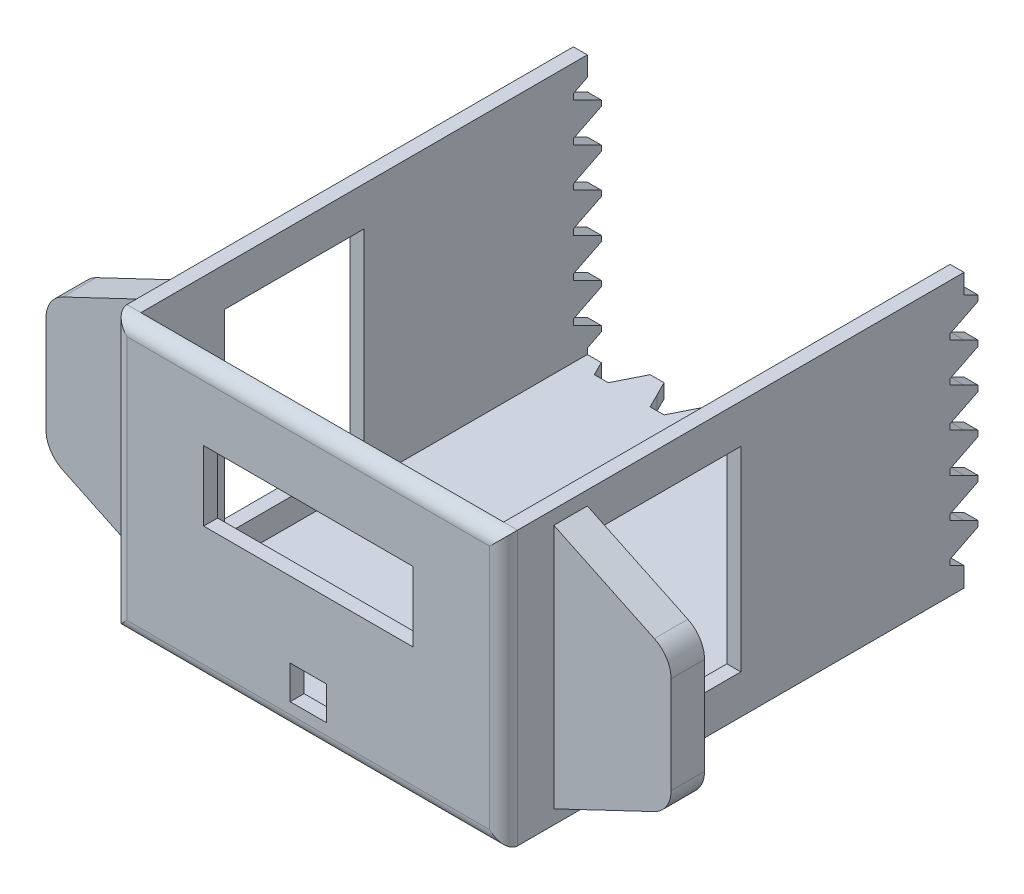
from build123d import *
from OCP.BRepFilletAPI import BRepFilletAPI_MakeChamfer

# Parameters (mm, degrees)
SKETCH1_W                  = 140
SKETCH1_H                  = 98
BOSS_EXTRUDE1_DEPTH        = 170
FACE_FILLET_R              = 5
INTERIOR_START             = -5
INTERIOR_SKETCH_W          = 130
INTERIOR_SKETCH_H          = 93
INTERIOR_CUT_DEPTH         = 199.045897155
DISPLAY_SKETCH_W           = 75
DISPLAY_SKETCH_H           = 25
DISPLAY_CUT_DEPTH          = 5
WINDOW_CUT_REACH           = 231.478
WINDOW_SKETCH_W            = 50
WINDOW_SKETCH_H            = 70
TEETH_START                = -5
TEETH_CUT_1_DEPTH          = 5
TEETH_CUT_2_DEPTH          = 5
TEETH_CUT_BOT_DEPTH        = 5
WIRE_HOLE_SKETCH_W         = 13
WIRE_HOLE_SKETCH_H         = 12
WIRE_HOLE_CUT_DEPTH        = 5
SERVO_START                = -5
MOUNT_SKETCH_1_W           = 12
MOUNT_SKETCH_1_H           = 88
SERVO_MOUNT_1_DEPTH        = 42
MOUNT_SKETCH_2_W           = 12
MOUNT_SKETCH_2_H           = 88
SERVO_MOUNT_2_DEPTH        = 42
SERVO_START_2              = -12
INDENT_SKETCH_1_R          = 10.6
SERVO_INDENT_1_DEPTH       = 2.5
INDENT_SKETCH_2_R          = 10.6
SERVO_INDENT_2_DEPTH       = 2.5
SERVO_MOUNT_CHAMFER_SIZE   = 42
SERVO_MOUNT_CHAMFER_SIZE_2 = 20
SERVO_MOUNT_FILLET_R       = 10.5
BELLY_SKETCH_W             = 3.5
BELLY_SKETCH_H             = 3.983739837
BELLY_SUPPORTS_DEPTH       = 31
BELLY_START                = 31
SKETCH2_4_W                = 3.5
SKETCH2_4_H                = 3.983739837
BELLY_PLATE_DEPTH          = 4
BELLY_CUT_SKETCH_W         = 54.5
BELLY_CUT_SKETCH_H         = 66.016260163
BELLY_CUT_DEPTH            = 2
WIRE_HOLE_2_SKETCH_R       = 10
WIRE_HOLE_2_CUT_DEPTH      = 5


# Read off the part's stored shape, not the designer's step: Teeth Cut 1, Teeth Cut 2, Teeth Cut Bot
with BuildPart() as part:
    # Sketch1 → Boss-Extrude1 (new body)
    with BuildSketch(Plane.XY):
        with Locations((-20.374701232, -15.49844749)):
            Rectangle(SKETCH1_W, SKETCH1_H)
    extrude(amount=-BOSS_EXTRUDE1_DEPTH)

    # Face Fillet
    face_fillet_edges = [part.edges().sort_by_distance(p)[0] for p in [
        (-20.374701232, 33.50155251, 0),
        (49.625298768, -15.49844749, 0),
        (-20.374701232, -64.49844749, 0),
        (-90.374701232, -15.49844749, 0),
    ]]
    fillet(face_fillet_edges, radius=FACE_FILLET_R)

    # Interior Sketch → Interior Cut (cut, through all)
    with BuildSketch(Plane.XY.offset(INTERIOR_START)):
        with Locations((-20.374701232, -12.99844749)):
            Rectangle(INTERIOR_SKETCH_W, INTERIOR_SKETCH_H)
    extrude(amount=-INTERIOR_CUT_DEPTH, mode=Mode.SUBTRACT)

    # Display Sketch → Display Cut (cut)
    with BuildSketch(Plane.XY):
        with Locations((-20.374701232, -3.99844749)):
            Rectangle(DISPLAY_SKETCH_W, DISPLAY_SKETCH_H)
    extrude(amount=-DISPLAY_CUT_DEPTH, mode=Mode.SUBTRACT)

    # Window Cut: up to this face of the body (flat: up to its plane)
    window_cut_end = Plane(part.part.faces().sort_by_distance((-90.374701232, -15.49844749, -87.5))[0])
    # Window Sketch → Window Cut (cut, up to the picked face)
    with BuildSketch(Plane(origin=(49.625298768, 0, 0), x_dir=(0, 0, -1), z_dir=(1, 0, 0)), mode=Mode.PRIVATE) as window_cut_sk1:
        with Locations((60, -15.49844749)):
            Rectangle(WINDOW_SKETCH_W, WINDOW_SKETCH_H)
    window_cut_tool1 = split(extrude(window_cut_sk1.sketch, amount=-WINDOW_CUT_REACH, mode=Mode.PRIVATE), bisect_by=window_cut_end, keep=Keep.BOTH, mode=Mode.PRIVATE)
    add(window_cut_tool1.solids().sort_by(Axis((49.625299, -15.498447, -60), (-1, 0, 0)))[0], mode=Mode.SUBTRACT)

    # Teeth Cut 1 outline → Teeth Cut 1 (cut)
    with BuildSketch(Plane(origin=(49.625298768, 0, 0), x_dir=(0, 0, -1), z_dir=(1, 0, 0)).offset(TEETH_START)):
        Polygon((170, 22.00155251), (160, 17.00155251), (160, 15.00155251), (170, 10.00155251), align=None)
        Polygon((165, 26.50155251), (170, 24.00155251), (170, 33.50155251), (165, 33.50155251), align=None)
        Polygon((170, -64.49844749), (170, -47.99844749), (160, -52.99844749), (160, -54.99844749), (165, -57.49844749), (165, -64.49844749), align=None)
        Polygon((170, -45.99844749), (170, -33.99844749), (160, -38.99844749), (160, -40.99844749), align=None)
        Polygon((170, -31.99844749), (170, -19.99844749), (160, -24.99844749), (160, -26.99844749), align=None)
        Polygon((170, -17.99844749), (170, -5.99844749), (160, -10.99844749), (160, -12.99844749), align=None)
        Polygon((170, -3.99844749), (170, 8.00155251), (160, 3.00155251), (160, 1.00155251), align=None)
    extrude(amount=TEETH_CUT_1_DEPTH, mode=Mode.SUBTRACT)

    # Teeth Cut 2 outline → Teeth Cut 2 (cut)
    with BuildSketch(Plane.ZY.offset(90.374701232).offset(TEETH_START)):
        Polygon((-170, -52.99844749), (-160, -47.99844749), (-160, -45.99844749), (-170, -40.99844749), align=None)
        Polygon((-165, -57.49844749), (-170, -54.99844749), (-170, -64.49844749), (-165, -64.49844749), align=None)
        Polygon((-170, 33.50155251), (-170, 17.00155251), (-160, 22.00155251), (-160, 24.00155251), (-165, 26.50155251), (-165, 33.50155251), align=None)
        Polygon((-170, 15.00155251), (-170, 3.00155251), (-160, 8.00155251), (-160, 10.00155251), align=None)
        Polygon((-170, 1.00155251), (-170, -10.99844749), (-160, -5.99844749), (-160, -3.99844749), align=None)
        Polygon((-170, -12.99844749), (-170, -24.99844749), (-160, -19.99844749), (-160, -17.99844749), align=None)
        Polygon((-170, -26.99844749), (-170, -38.99844749), (-160, -33.99844749), (-160, -31.99844749), align=None)
    extrude(amount=TEETH_CUT_2_DEPTH, mode=Mode.SUBTRACT)

    # Teeth Cut Bot outline → Teeth Cut Bot (cut)
    with BuildSketch(Plane.XZ.offset(64.49844749).offset(TEETH_START)):
        Polygon((-67.874701232, -170), (-72.874701232, -160), (-77.874701232, -160), (-80.374701232, -165), (-85.374701232, -165), (-85.374701232, -170), align=None)
        Polygon((39.625298768, -165), (37.125298768, -170), (44.625298768, -170), (44.625298768, -165), align=None)
        Polygon((22.125298768, -160), (17.125298768, -170), (32.125298768, -170), (27.125298768, -160), align=None)
        Polygon((2.125298768, -160), (-2.874701232, -170), (12.125298768, -170), (7.125298768, -160), align=None)
        Polygon((-17.874701232, -160), (-22.874701232, -170), (-7.874701232, -170), (-12.874701232, -160), align=None)
        Polygon((-37.874701232, -160), (-42.874701232, -170), (-27.874701232, -170), (-32.874701232, -160), align=None)
        Polygon((-57.874701232, -160), (-62.874701232, -170), (-47.874701232, -170), (-52.874701232, -160), align=None)
    extrude(amount=TEETH_CUT_BOT_DEPTH, mode=Mode.SUBTRACT)

    # Wire Hole Sketch → Wire Hole Cut (cut)
    with BuildSketch(Plane.XY):
        with Locations((-20.374701232, -49.49844749)):
            Rectangle(WIRE_HOLE_SKETCH_W, WIRE_HOLE_SKETCH_H)
    extrude(amount=-WIRE_HOLE_CUT_DEPTH, mode=Mode.SUBTRACT)

    # Mount Sketch 1 → Servo Mount 1 (add)
    with BuildSketch(Plane.ZY.offset(-44.625298768).offset(SERVO_START)):
        with Locations((-24, -15.49844749)):
            Rectangle(MOUNT_SKETCH_1_W, MOUNT_SKETCH_1_H)
    extrude(amount=-SERVO_MOUNT_1_DEPTH)

    # Mount Sketch 2 → Servo Mount 2 (add)
    with BuildSketch(Plane(origin=(-85.374701232, 0, 0), x_dir=(0, 0, -1), z_dir=(1, 0, 0)).offset(SERVO_START)):
        with Locations((24, -15.49844749)):
            Rectangle(MOUNT_SKETCH_2_W, MOUNT_SKETCH_2_H)
    extrude(amount=-SERVO_MOUNT_2_DEPTH)

    # Indent Sketch 1 → Servo Indent 1 (cut)
    with BuildSketch(Plane.XY.offset(-18).offset(SERVO_START_2)):
        with Locations(Location((70.625298768, -6.49844749, 0), (0, 0, 180))):
            Circle(INDENT_SKETCH_1_R)
    extrude(amount=SERVO_INDENT_1_DEPTH, mode=Mode.SUBTRACT)

    # Indent Sketch 2 → Servo Indent 2 (cut)
    with BuildSketch(Plane.XY.offset(-18).offset(SERVO_START_2)):
        with Locations(Location((-111.374701232, -6.49844749, 0), (0, 0, 180))):
            Circle(INDENT_SKETCH_2_R)
    extrude(amount=SERVO_INDENT_2_DEPTH, mode=Mode.SUBTRACT)

    # Servo Mount Chamfer
    servo_mount_chamfer_edges_1 = [part.edges().sort_by_distance(p)[0] for p in [
        (-132.374701232, -59.49844749, -24),
    ]]
    servo_mount_chamfer_side_1 = [part.faces().sort_by_distance(p)[0] for p in [
        (-131.974701232, -59.49844749, -24),
    ]]
    servo_mount_chamfer_edges_2 = [part.edges().sort_by_distance(p)[0] for p in [
        (91.625298768, -59.49844749, -24),
    ]]
    servo_mount_chamfer_side_2 = [part.faces().sort_by_distance(p)[0] for p in [
        (91.225298768, -59.49844749, -24),
    ]]
    servo_mount_chamfer_edges_3 = [part.edges().sort_by_distance(p)[0] for p in [
        (91.625298768, 28.50155251, -24),
    ]]
    servo_mount_chamfer_side_3 = [part.faces().sort_by_distance(p)[0] for p in [
        (91.225298768, 28.50155251, -24),
    ]]
    servo_mount_chamfer_edges_4 = [part.edges().sort_by_distance(p)[0] for p in [
        (-132.374701232, 28.50155251, -24),
    ]]
    servo_mount_chamfer_side_4 = [part.faces().sort_by_distance(p)[0] for p in [
        (-131.974701232, 28.50155251, -24),
    ]]
    servo_mount_chamfer = BRepFilletAPI_MakeChamfer(part.part.solid().wrapped)
    for e in servo_mount_chamfer_edges_1:
        servo_mount_chamfer.Add(SERVO_MOUNT_CHAMFER_SIZE - 0.0001, SERVO_MOUNT_CHAMFER_SIZE_2 - 0.0001, e.wrapped, servo_mount_chamfer_side_1[0].wrapped)
    for e in servo_mount_chamfer_edges_2:
        servo_mount_chamfer.Add(SERVO_MOUNT_CHAMFER_SIZE - 0.0001, SERVO_MOUNT_CHAMFER_SIZE_2 - 0.0001, e.wrapped, servo_mount_chamfer_side_2[0].wrapped)
    for e in servo_mount_chamfer_edges_3:
        servo_mount_chamfer.Add(SERVO_MOUNT_CHAMFER_SIZE - 0.0001, SERVO_MOUNT_CHAMFER_SIZE_2 - 0.0001, e.wrapped, servo_mount_chamfer_side_3[0].wrapped)
    for e in servo_mount_chamfer_edges_4:
        servo_mount_chamfer.Add(SERVO_MOUNT_CHAMFER_SIZE - 0.0001, SERVO_MOUNT_CHAMFER_SIZE_2 - 0.0001, e.wrapped, servo_mount_chamfer_side_4[0].wrapped)
    add(Compound.cast(servo_mount_chamfer.Shape()), mode=Mode.REPLACE)  # a hair under: the kernel refuses the full size

    # Servo Mount Fillet
    servo_mount_fillet_edges = [part.edges().sort_by_distance(p)[0] for p in [
        (91.625298768, -39.49854749, -24),
        (91.625298768, 8.50165251, -24),
        (-132.374701232, -39.49854749, -24),
        (-132.374701232, 8.50165251, -24),
    ]]
    fillet(servo_mount_fillet_edges, radius=SERVO_MOUNT_FILLET_R)

    # Belly Sketch → Belly Supports (add)
    with BuildSketch(Plane.XZ.offset(64.49844749)):
        with Locations((-49.374701232, -86.991869919)):
            Rectangle(BELLY_SKETCH_W, BELLY_SKETCH_H)
        with Locations((8.625298768, -86.991869919)):
            Rectangle(BELLY_SKETCH_W, BELLY_SKETCH_H)
        with Locations((-49.374701232, -153.008130081)):
            Rectangle(BELLY_SKETCH_W, BELLY_SKETCH_H)
        with Locations((8.625298768, -153.008130081)):
            Rectangle(BELLY_SKETCH_W, BELLY_SKETCH_H)
    extrude(amount=BELLY_SUPPORTS_DEPTH)

    # Sketch2<4> → Belly Plate (add)
    with BuildSketch(Plane.XZ.offset(64.49844749).offset(BELLY_START)):
        Polygon((6.875298768, -85), (-47.624701232, -85), (-47.624701232, -88.983739837), (-51.124701232, -88.983739837), (-51.124701232, -151.016260163), (-47.624701232, -151.016260163), (-47.624701232, -155), (6.875298768, -155), (6.875298768, -151.016260163), (10.375298768, -151.016260163), (10.375298768, -88.983739837), (6.875298768, -88.983739837), align=None)
        with Locations((-49.374701232, -86.991869919)):
            Rectangle(SKETCH2_4_W, SKETCH2_4_H)
        with Locations((8.625298768, -86.991869919)):
            Rectangle(SKETCH2_4_W, SKETCH2_4_H)
        with Locations((8.625298768, -153.008130081)):
            Rectangle(SKETCH2_4_W, SKETCH2_4_H)
        with Locations((-49.374701232, -153.008130081)):
            Rectangle(SKETCH2_4_W, SKETCH2_4_H)
    extrude(amount=BELLY_PLATE_DEPTH)

    # Belly Cut Sketch → Belly Cut (cut)
    with BuildSketch(Plane(origin=(0, -95.49844749, 0), x_dir=(1, 0, 0), z_dir=(0, 1, 0))):
        with Locations((-20.374701232, 121.991869919)):
            Rectangle(BELLY_CUT_SKETCH_W, BELLY_CUT_SKETCH_H)
    extrude(amount=-BELLY_CUT_DEPTH, mode=Mode.SUBTRACT)

    # Wire Hole 2 Sketch → Wire Hole 2 Cut (cut)
    with BuildSketch(Plane.XZ.offset(64.49844749)):
        with Locations(Location((20.375298768, -75, 0), (0, 0, 270))):
            Circle(WIRE_HOLE_2_SKETCH_R)
    extrude(amount=-WIRE_HOLE_2_CUT_DEPTH, mode=Mode.SUBTRACT)


solid = part.part
